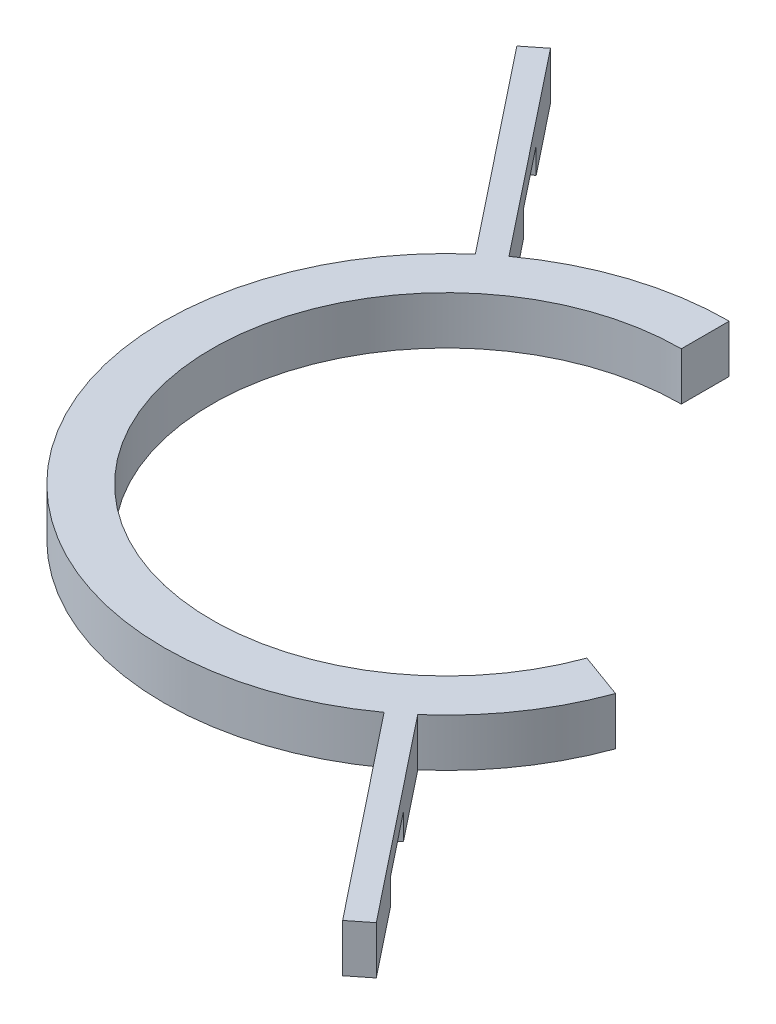
from build123d import *

# Parameters (mm, degrees)
BOSS_EXTRUDE2_DEPTH = 1
SKETCH2_W           = 1.658994132
SKETCH2_H           = 0.541528476
CUT_EXTRUDE2_DEPTH  = 1


with BuildPart() as part:
    # Sketch1 → Boss-Extrude2 (new body)
    with BuildSketch(Plane(origin=(0, 0, 0), x_dir=(1, 0, 0), z_dir=(0, 1, 0))):
        with BuildLine():
            Line((0, 4.9), (0, 5.9))
            ThreePointArc((0, 5.9), (-1.823735912, 5.611059376), (-3.468844234, 4.772538076))
            Line((-3.468844234, 4.772538076), (-6.797914, 8.966842466))
            Line((-6.797914, 8.966842466), (-7.189546777, 8.655998827))
            Line((-7.189546777, 8.655998827), (-3.860477011, 4.461694437))
            ThreePointArc((-3.860477011, 4.461694437), (-4.621266772, -3.667954937), (3.468844234, -4.772538076))
            Line((3.468844234, -4.772538076), (6.797914, -8.966842466))
            Line((6.797914, -8.966842466), (7.189546777, -8.655998827))
            Line((7.189546777, -8.655998827), (3.860477011, -4.461694437))
            ThreePointArc((3.860477011, -4.461694437), (4.858490871, -3.347396967), (5.544186463, -2.017918846))
            Line((5.544186463, -2.017918846), (4.604493842, -1.675898702))
            ThreePointArc((4.604493842, -1.675898702), (-4.013845017, -2.810524538), (0, 4.9))
        make_face()
    extrude(amount=BOSS_EXTRUDE2_DEPTH)

    # Sketch2 → Cut-Extrude2 (cut)
    with BuildSketch(Plane(origin=(-0.195816389, 0, 0.155421819), x_dir=(0.6216872774183269, 0, 0.7832655546468187), z_dir=(-0.7832655546468187, 0, 0.6216872774183269))):
        with Locations((8.572148247, 0.270764238)):
            Rectangle(SKETCH2_W, SKETCH2_H)
        with Locations((-8.572148247, 0.270764238)):
            Rectangle(SKETCH2_W, SKETCH2_H)
    extrude(amount=-CUT_EXTRUDE2_DEPTH, mode=Mode.SUBTRACT)


solid = part.part
